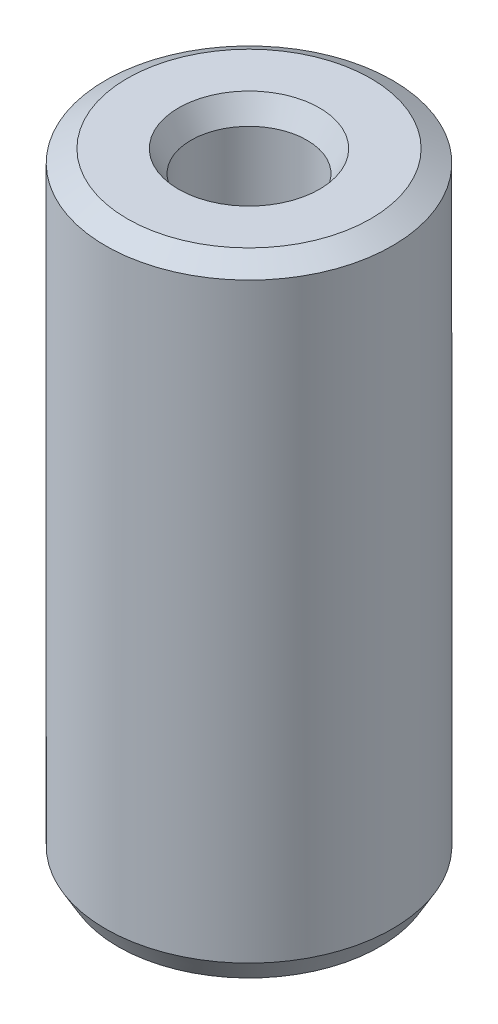
from build123d import *
from OCP.BRepFilletAPI import BRepFilletAPI_MakeChamfer

# Parameters (mm, degrees)
SKETCH1_R           = 45
BOSS_EXTRUDE1_DEPTH = 196.344045283
SKETCH2_R           = 18.192439877
CUT_EXTRUDE1_DEPTH  = 207.400058426
CHAMFER1_SIZE       = 3.933576809
CHAMFER1_SIZE2      = 6.813154889


with BuildPart() as part:
    # Sketch1 → Boss-Extrude1 (new body)
    with BuildSketch(Plane(origin=(0, 0, 0), x_dir=(1, 0, 0), z_dir=(0, 1, 0))):
        Circle(SKETCH1_R)
    extrude(amount=BOSS_EXTRUDE1_DEPTH)

    # Sketch2 → Cut-Extrude1 (cut, through all)
    with BuildSketch(Plane(origin=(0, 0, 0), x_dir=(1, 0, 0), z_dir=(0, 1, 0))):
        Circle(SKETCH2_R)
    extrude(amount=CUT_EXTRUDE1_DEPTH, mode=Mode.SUBTRACT)

    # Chamfer1: one chamfer whose edges measure the first distance from different faces: ONE call of the kernel's chamfer builder (chamfer() names one face for all edges)
    chamfer1_edges_1 = [part.edges().sort_by_distance(p)[0] for p in [
        (-18.192439877, 196.344045283, 0),
    ]]
    chamfer1_side_1 = [part.faces().sort_by_distance(p)[0] for p in [
        (-43.727207794, 196.344045283, 0),
    ]]
    chamfer1_edges_2 = [part.edges().sort_by_distance(p)[0] for p in [
        (-18.192439877, 0, 0),
    ]]
    chamfer1_side_2 = [part.faces().sort_by_distance(p)[0] for p in [
        (-18.192439877, 98.172022642, 0),
    ]]
    chamfer1_edges_3 = [part.edges().sort_by_distance(p)[0] for p in [
        (-45, 0, 0),
    ]]
    chamfer1_side_3 = [part.faces().sort_by_distance(p)[0] for p in [
        (-43.727207794, 0, 0),
    ]]
    chamfer1_edges_4 = [part.edges().sort_by_distance(p)[0] for p in [
        (-45, 196.344045283, 0),
    ]]
    chamfer1_side_4 = [part.faces().sort_by_distance(p)[0] for p in [
        (-45, 98.172022642, 0),
    ]]
    chamfer1 = BRepFilletAPI_MakeChamfer(part.part.solid().wrapped)
    for e in chamfer1_edges_1:
        chamfer1.Add(CHAMFER1_SIZE, CHAMFER1_SIZE2, e.wrapped, chamfer1_side_1[0].wrapped)  # the first distance lies on this face
    for e in chamfer1_edges_2:
        chamfer1.Add(CHAMFER1_SIZE, CHAMFER1_SIZE2, e.wrapped, chamfer1_side_2[0].wrapped)  # the first distance lies on this face
    for e in chamfer1_edges_3:
        chamfer1.Add(CHAMFER1_SIZE, CHAMFER1_SIZE2, e.wrapped, chamfer1_side_3[0].wrapped)  # the first distance lies on this face
    for e in chamfer1_edges_4:
        chamfer1.Add(CHAMFER1_SIZE, CHAMFER1_SIZE2, e.wrapped, chamfer1_side_4[0].wrapped)  # the first distance lies on this face
    add(Compound.cast(chamfer1.Shape()), mode=Mode.REPLACE)


solid = part.part
